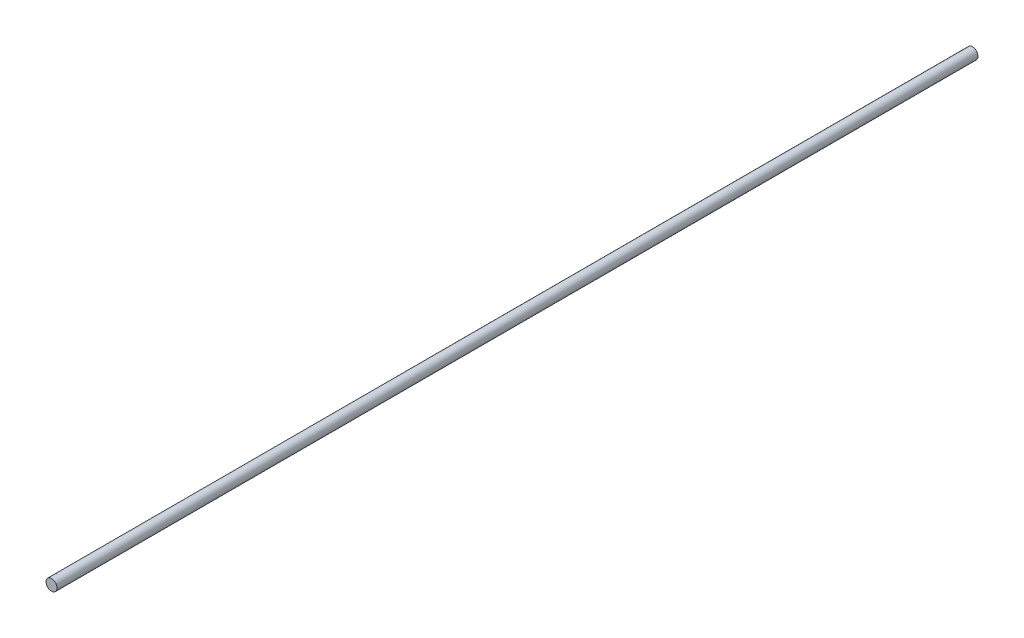
from build123d import *

# Parameters (mm, degrees)
SKETCH_1_R      = 2.999515394
EXTRUDE_1_DEPTH = 500


with BuildPart() as part:
    # Эскиз1 → Бобышка-Вытянуть1 (new body)
    with BuildSketch(Plane(origin=(0, 0, 0), x_dir=(-1, 0, 0), z_dir=(0, 0, 1))):
        with Locations((-6.5, 15.25)):
            Circle(SKETCH_1_R)
    extrude(amount=EXTRUDE_1_DEPTH)


solid = part.part
